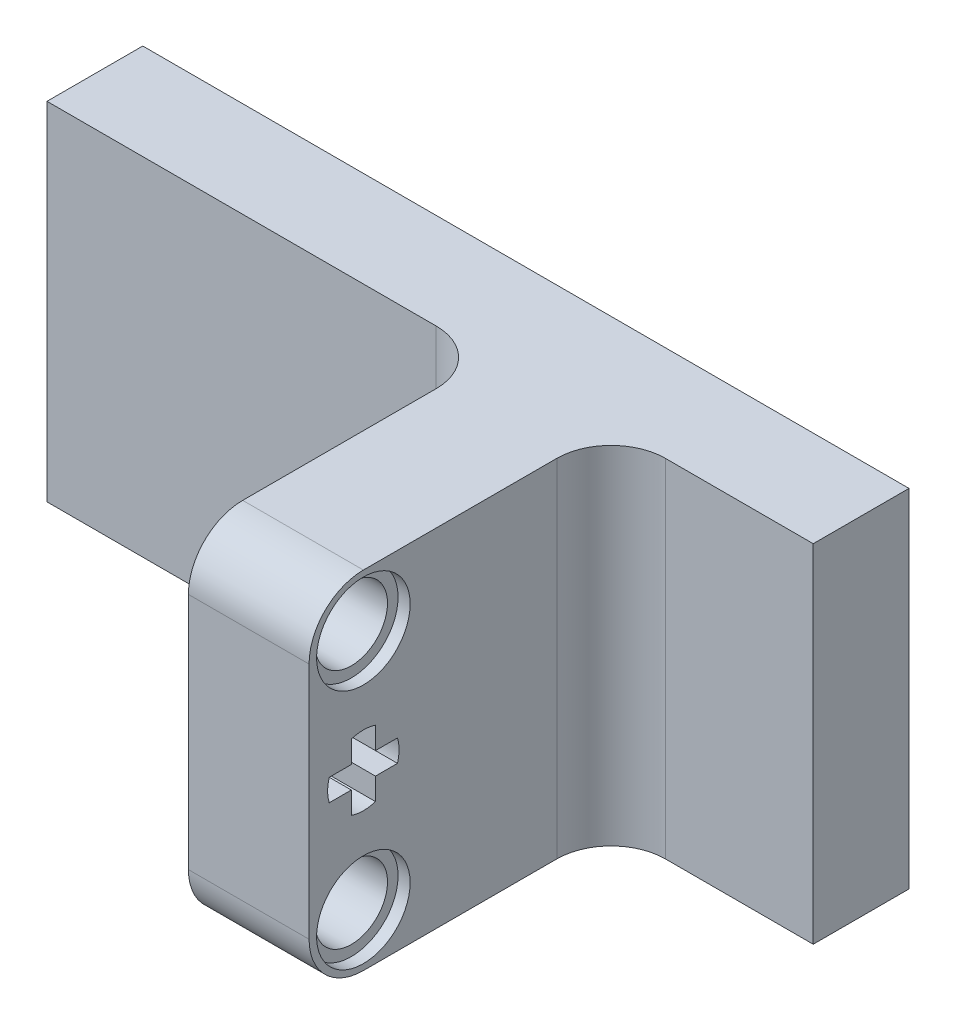
from build123d import *

# Parameters (mm, degrees)
BOSS_EXTRUDE1_DEPTH = 11.5
SKETCH3_R           = 2.4
CUT_EXTRUDE1_DEPTH  = 46.489009619
SKETCH3_3_R         = 3.1
SKETCH3_3_R_2       = 2.4
CUT_EXTRUDE2_DEPTH  = 0.8
FILLET1_R           = 3.6


with BuildPart() as part:
    # Sketch2 → Boss-Extrude1 (new, symmetric)
    with BuildSketch(Plane(origin=(0, 0, 0), x_dir=(1, 0, 0), z_dir=(0, 1, 0))):
        Polygon((4, -3.175), (4, -19.599999916), (4, -23.199999916), (12, -23.199999916), (12, -19.599999916), (12, -3.175), (25.4, -3.175), (25.4, 3.175), (-25.4, 3.175), (-25.4, -3.175), align=None)
    extrude(amount=BOSS_EXTRUDE1_DEPTH, both=True)

    # Sketch3 → Cut-Extrude1 (cut, through all)
    with BuildSketch(Plane(origin=(12, 0, 0), x_dir=(0, 0, -1), z_dir=(1, 0, 0))):
        with BuildLine():
            Line((-20.399999916, 2.19411255), (-20.399999916, 0.73137085))
            Line((-20.399999916, 0.73137085), (-21.862741616, 0.73137085))
            ThreePointArc((-21.862741616, 0.73137085), (-21.967727251, 0), (-21.862741616, -0.73137085))
            Line((-21.862741616, -0.73137085), (-20.399999916, -0.73137085))
            Line((-20.399999916, -0.73137085), (-20.399999916, -2.19411255))
            ThreePointArc((-20.399999916, -2.19411255), (-19.599999916, -2.320249175), (-18.799999916, -2.19411255))
            Line((-18.799999916, -2.19411255), (-18.799999916, -0.73137085))
            Line((-18.799999916, -0.73137085), (-17.337258216, -0.73137085))
            ThreePointArc((-17.337258216, -0.73137085), (-17.232272581, 0), (-17.337258216, 0.73137085))
            Line((-17.337258216, 0.73137085), (-18.799999916, 0.73137085))
            Line((-18.799999916, 0.73137085), (-18.799999916, 2.19411255))
            ThreePointArc((-18.799999916, 2.19411255), (-19.599999916, 2.320249175), (-20.399999916, 2.19411255))
        make_face()
        with Locations((-19.599999916, 8)):
            Circle(SKETCH3_R)
        with Locations((-19.599999916, -8)):
            Circle(SKETCH3_R)
    extrude(amount=-CUT_EXTRUDE1_DEPTH, mode=Mode.SUBTRACT)

    # Sketch3<3> → Cut-Extrude2 (cut)
    # profile 1 of 2: a face of its own
    with BuildSketch(Plane(origin=(12, 0, 0), x_dir=(0, 0, -1), z_dir=(1, 0, 0))):
        with Locations((-19.599999916, 8)):
            Circle(SKETCH3_3_R)
        with Locations((-19.599999916, 8)):
            Circle(SKETCH3_3_R_2, mode=Mode.SUBTRACT)
    # profile 2 of 2: a face of its own
    with BuildSketch(Plane(origin=(12, 0, 0), x_dir=(0, 0, -1), z_dir=(1, 0, 0))):
        with Locations((-19.599999916, -8)):
            Circle(SKETCH3_3_R)
        with Locations((-19.599999916, -8)):
            Circle(SKETCH3_3_R_2, mode=Mode.SUBTRACT)
    cut_extrude2 = extrude(amount=-CUT_EXTRUDE2_DEPTH, mode=Mode.SUBTRACT)

    # Mirror1: Cut-Extrude2 across plane
    add(cut_extrude2.mirror(Plane(origin=(8, 0, 0), x_dir=(0, 0, 1), z_dir=(1, 0, 0))), mode=Mode.SUBTRACT)

    # Fillet1
    fillet1_edges = [part.edges().sort_by_distance(p)[0] for p in [
        (8, -11.5, 23.199999916),
        (8, 11.5, 23.199999916),
        (4, 0, 3.175),
        (12, 0, 3.175),
    ]]
    fillet(fillet1_edges, radius=FILLET1_R)


solid = part.part
